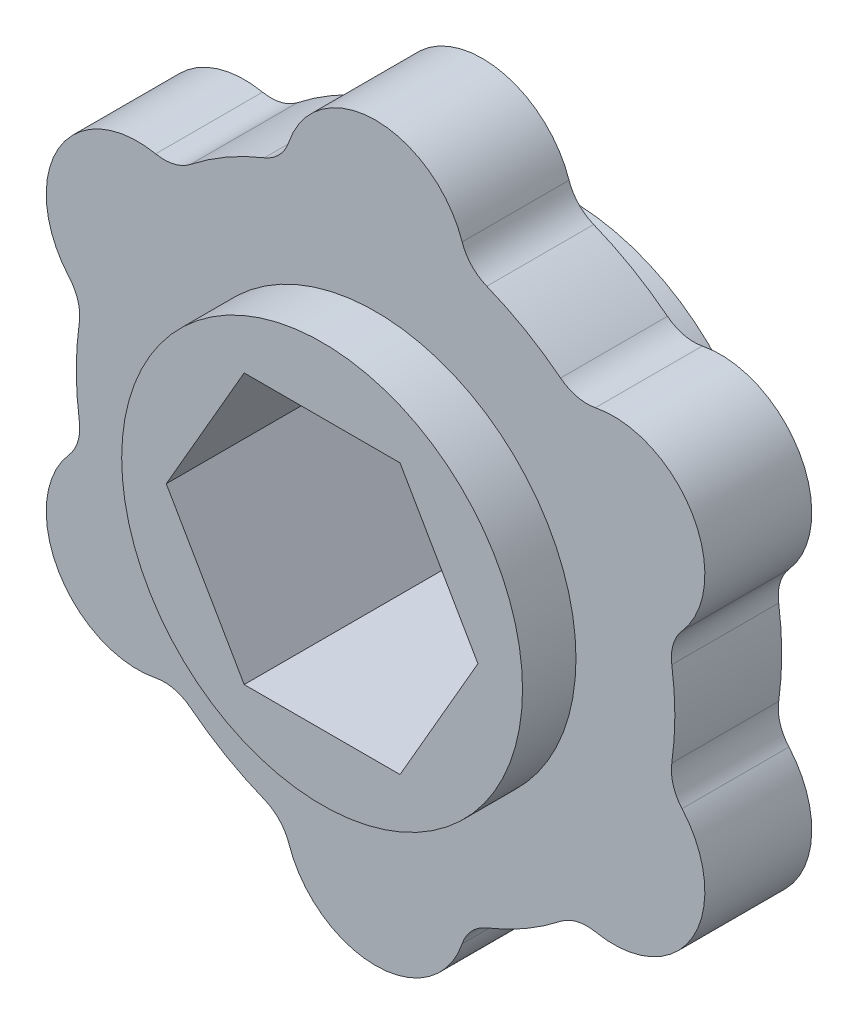
from build123d import *

# Parameters (mm, degrees)
BOSS_EXTRUDE2_DEPTH      = 5.08
FILLET1_R                = 2.032
CUT_EXTRUDE1_DEPTH       = 24.94682426
BOSS_EXTRUDE3_DEPTH      = 4.143000096
BOSS_EXTRUDE3_DEPTH_BACK = 7.62
SKETCH7_R                = 9.525


with BuildPart() as part:
    # Sketch5 → Boss-Extrude2 (new body)
    with BuildSketch(Plane.XY):
        with BuildLine():
            ThreePointArc((13.895294195, -3.040226179), (14.224, 0), (13.895294195, 3.040226179))
            ThreePointArc((13.895294195, 3.040226179), (15.067976, 8.6995), (9.580560202, 10.513564677))
            ThreePointArc((9.580560202, 10.513564677), (7.112, 12.318345343), (4.314733993, 13.553790856))
            ThreePointArc((4.314733993, 13.553790856), (0, 17.399), (-4.314733993, 13.553790856))
            ThreePointArc((-4.314733993, 13.553790856), (-7.112, 12.318345343), (-9.580560202, 10.513564677))
            ThreePointArc((-9.580560202, 10.513564677), (-15.067976, 8.6995), (-13.895294195, 3.040226179))
            ThreePointArc((-13.895294195, 3.040226179), (-14.224, 0), (-13.895294195, -3.040226179))
            ThreePointArc((-13.895294195, -3.040226179), (-15.067976, -8.6995), (-9.580560202, -10.513564677))
            ThreePointArc((-9.580560202, -10.513564677), (-7.112, -12.318345343), (-4.314733993, -13.553790856))
            ThreePointArc((-4.314733993, -13.553790856), (0, -17.399), (4.314733993, -13.553790856))
            ThreePointArc((4.314733993, -13.553790856), (7.112, -12.318345343), (9.580560202, -10.513564677))
            ThreePointArc((9.580560202, -10.513564677), (15.067976, -8.6995), (13.895294195, -3.040226179))
        make_face()
    extrude(amount=BOSS_EXTRUDE2_DEPTH)

    # Fillet1
    fillet1_edges = [part.edges().sort_by_distance(p)[0] for p in [
        (-9.580560202, 10.513564677, 2.54),
        (-4.314733993, 13.553790856, 2.54),
        (4.314733993, 13.553790856, 2.54),
        (9.580560202, 10.513564677, 2.54),
        (13.895294195, 3.040226179, 2.54),
        (13.895294195, -3.040226179, 2.54),
        (9.580560202, -10.513564677, 2.54),
        (4.314733993, -13.553790856, 2.54),
        (-4.314733993, -13.553790856, 2.54),
        (-9.580560202, -10.513564677, 2.54),
        (-13.895294195, -3.040226179, 2.54),
        (-13.895294195, 3.040226179, 2.54),
    ]]
    fillet(fillet1_edges, radius=FILLET1_R)

    # Sketch6 → Cut-Extrude1 (cut, through all)
    with BuildSketch(Plane.XY.offset(5.08)):
        Polygon((7.405671903, 0), (3.702835951, 6.4135), (-3.702835951, 6.4135), (-7.405671903, 0), (-3.702835951, -6.4135), (3.702835951, -6.4135), align=None)
    extrude(amount=-CUT_EXTRUDE1_DEPTH, mode=Mode.SUBTRACT)

    # Sketch7 → Boss-Extrude3 (add, two sides: drawn at the far end of the back side and taken through both)
    with BuildSketch(Plane(origin=(0, 0, 0), x_dir=(-1, 0, 0), z_dir=(0, 0, -1)).offset(-BOSS_EXTRUDE3_DEPTH_BACK)):
        Circle(SKETCH7_R)
        Polygon((-7.405671903, 0), (-3.702835951, 6.4135), (3.702835951, 6.4135), (7.405671903, 0), (3.702835951, -6.4135), (-3.702835951, -6.4135), align=None, mode=Mode.SUBTRACT)
    extrude(amount=BOSS_EXTRUDE3_DEPTH + BOSS_EXTRUDE3_DEPTH_BACK)


solid = part.part
